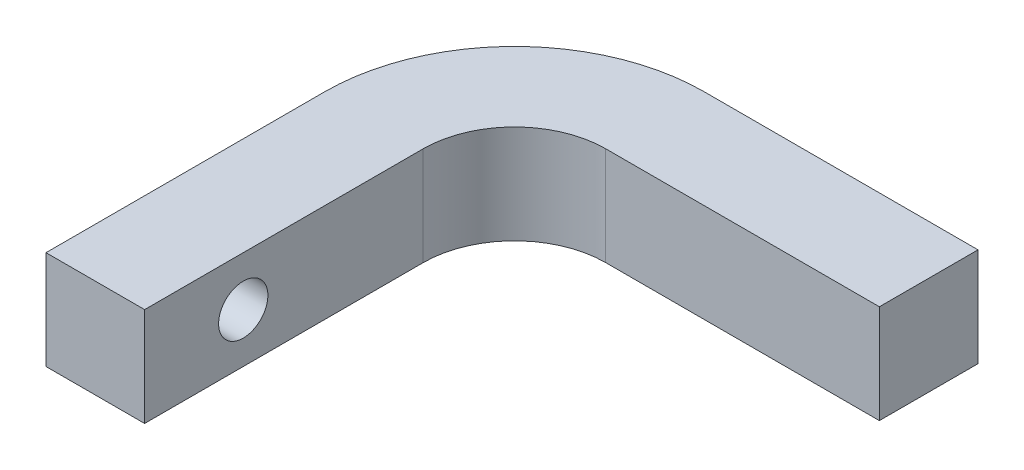
from build123d import *

# Parameters (mm, degrees)
BOSS_EXTRUDE1_DEPTH      = 4
BOSS_EXTRUDE1_DEPTH_BACK = 4
CUT_EXTRUDE1_DEPTH       = 49.333839078
CUT_EXTRUDE1_DEPTH_BACK  = 49.333839078
SKETCH2_R                = 2


with BuildPart() as part:
    # Sketch1 → Boss-Extrude1 (new, two sides: drawn at the far end of the back side and taken through both)
    with BuildSketch(Plane(origin=(0, 0, 0), x_dir=(1, 0, 0), z_dir=(0, 1, 0)).offset(-BOSS_EXTRUDE1_DEPTH_BACK)):
        with BuildLine():
            Line((-11.1, 0), (11.1, 0))
            Line((11.1, 0), (11.1, -8))
            Line((11.1, -8), (-11.1, -8))
            ThreePointArc((-11.1, -8), (-16.332590181, -10.167409819), (-18.5, -15.4))
            Line((-18.5, -15.4), (-18.5, -38))
            Line((-18.5, -38), (-26.5, -38))
            Line((-26.5, -38), (-26.5, -15.4))
            ThreePointArc((-26.5, -15.4), (-21.98944443, -4.51055557), (-11.1, 0))
        make_face()
    extrude(amount=BOSS_EXTRUDE1_DEPTH + BOSS_EXTRUDE1_DEPTH_BACK)

    # Sketch2 → Cut-Extrude1 (cut, two sides: drawn at the far end of the back side and taken through both)
    with BuildSketch(Plane.ZY.offset(18.5).offset(-CUT_EXTRUDE1_DEPTH_BACK)):
        with Locations((30, 0)):
            Circle(SKETCH2_R)
    extrude(amount=CUT_EXTRUDE1_DEPTH + CUT_EXTRUDE1_DEPTH_BACK, mode=Mode.SUBTRACT)


solid = part.part
